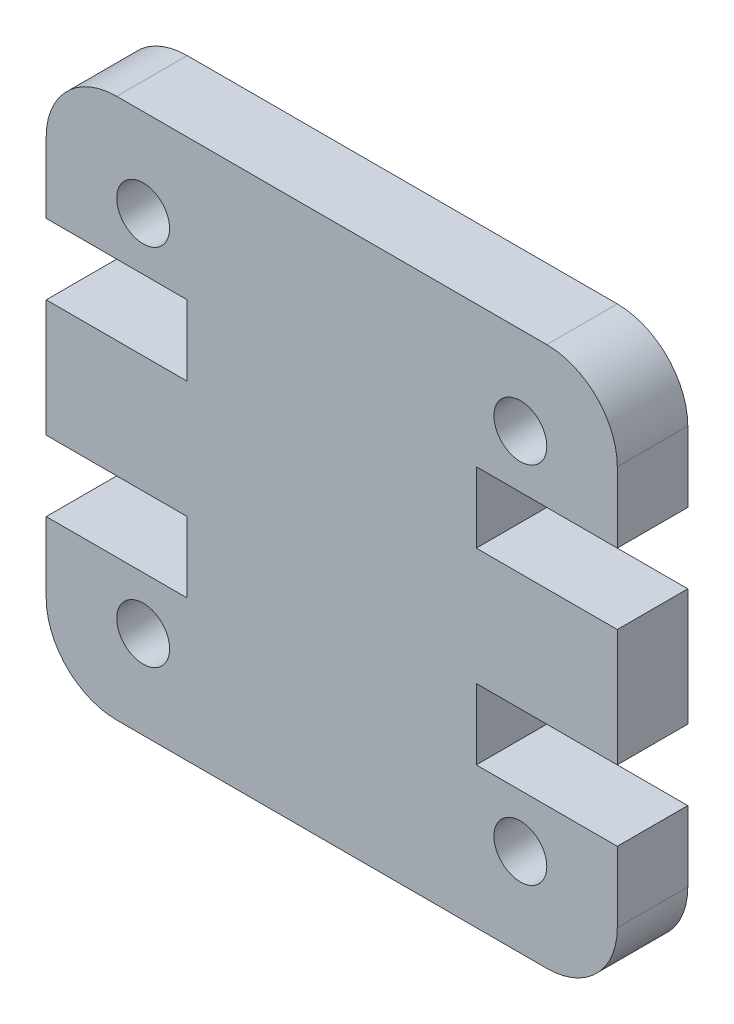
from build123d import *

# Parameters (mm, degrees)
SKETCH1_R           = 0.75
BOSS_EXTRUDE1_DEPTH = 2


with BuildPart() as part:
    # Sketch1 → Boss-Extrude1 (new body)
    with BuildSketch(Plane.XY):
        with BuildLine():
            Line((0, 9.325), (0, 6))
            Line((0, 6), (4, 6))
            Line((4, 6), (4, 4))
            Line((4, 4), (0, 4))
            Line((0, 4), (0, 2))
            ThreePointArc((0, 2), (0.585786438, 0.585786438), (2, 0))
            Line((2, 0), (14.2, 0))
            ThreePointArc((14.2, 0), (15.614213562, 0.585786438), (16.2, 2))
            Line((16.2, 2), (16.2, 4))
            Line((16.2, 4), (12.2, 4))
            Line((12.2, 4), (12.2, 6))
            Line((12.2, 6), (16.2, 6))
            Line((16.2, 6), (16.2, 9.325))
            Line((16.2, 9.325), (12.2, 9.325))
            Line((12.2, 9.325), (12.2, 11.325))
            Line((12.2, 11.325), (16.2, 11.325))
            Line((16.2, 11.325), (16.2, 13.325))
            ThreePointArc((16.2, 13.325), (15.614213562, 14.739213562), (14.2, 15.325))
            Line((14.2, 15.325), (2, 15.325))
            ThreePointArc((2, 15.325), (0.585786438, 14.739213562), (0, 13.325))
            Line((0, 13.325), (0, 11.325))
            Line((0, 11.325), (4, 11.325))
            Line((4, 11.325), (4, 9.325))
            Line((4, 9.325), (0, 9.325))
        make_face()
        with Locations((13.45, 2.5)):
            Circle(SKETCH1_R, mode=Mode.SUBTRACT)
        with Locations((2.75, 2.5)):
            Circle(SKETCH1_R, mode=Mode.SUBTRACT)
        with Locations((13.45, 12.825)):
            Circle(SKETCH1_R, mode=Mode.SUBTRACT)
        with Locations((2.75, 12.825)):
            Circle(SKETCH1_R, mode=Mode.SUBTRACT)
    extrude(amount=BOSS_EXTRUDE1_DEPTH)


solid = part.part
